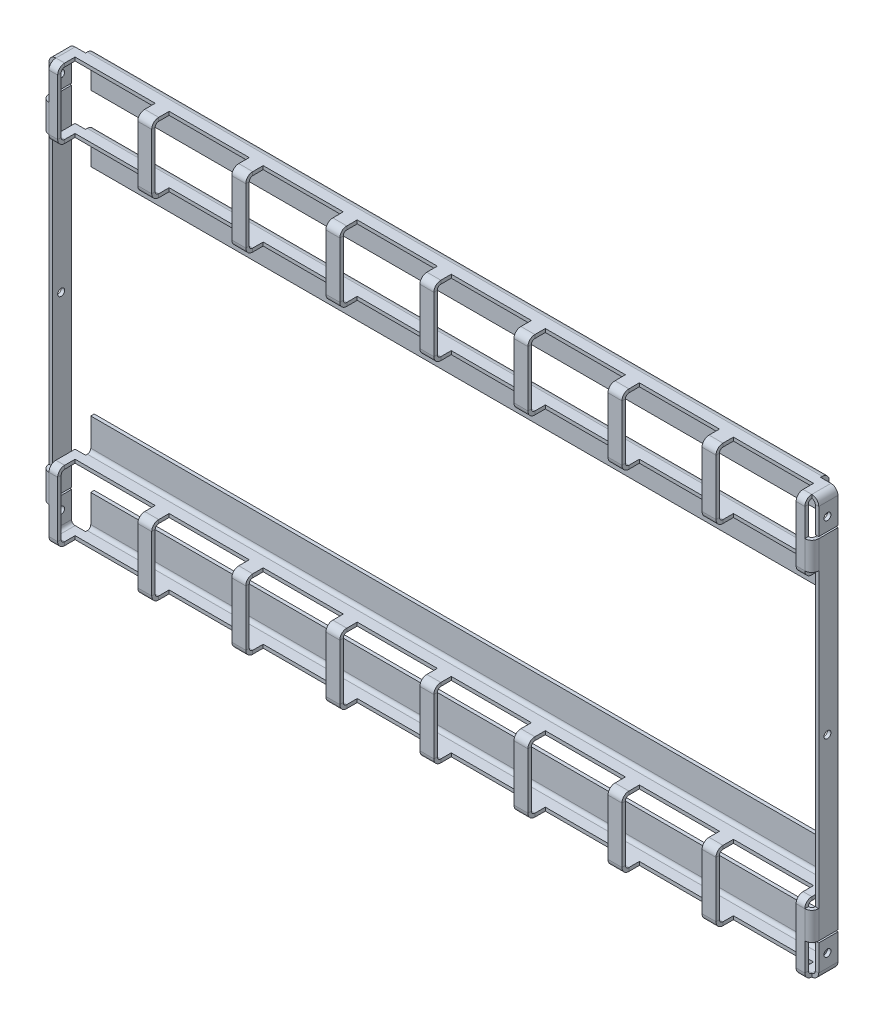
from build123d import *

# Parameters (mm, degrees)
SKETCH1_W                      = 442
SKETCH1_H                      = 40
BASE_FLANGE1_DEPTH             = 2
EDGE_FLANGE1_STRIP_W           = 12
EDGE_FLANGE1_STRIP_H           = 2
EDGE_FLANGE1_STRIP_CUT_DEPTH   = 40
EDGE_FLANGE1_STRIP_2_W         = 12
EDGE_FLANGE1_STRIP_2_H         = 2
EDGE_FLANGE1_STRIP_CUT_2_DEPTH = 40
EDGE_FLANGE1_DEPTH             = 40
EDGE_FLANGE1_PROFILE_W         = 120
EDGE_FLANGE1_PROFILE_H         = 16
EDGE_FLANGE1_FLAT_DEPTH        = 2
EDGE_FLANGE1_BEND_DEPTH        = 40
EDGE_FLANGE1_PROFILE_2_W       = 120
EDGE_FLANGE1_PROFILE_2_H       = 16
EDGE_FLANGE1_FLAT_2_DEPTH      = 2
EDGE_FLANGE2_STRIP_W           = 12
EDGE_FLANGE2_STRIP_H           = 2
EDGE_FLANGE2_STRIP_CUT_DEPTH   = 434
EDGE_FLANGE2_STRIP_2_W         = 12
EDGE_FLANGE2_STRIP_2_H         = 2
EDGE_FLANGE2_STRIP_CUT_2_DEPTH = 434
EDGE_FLANGE2_DEPTH             = 434
EDGE_FLANGE2_BEND_DEPTH        = 434
SKETCH19_W                     = 46
SKETCH19_H                     = 10
CUT_EXTRUDE1_DEPTH             = 450.626511674
SKETCH20_W                     = 4.121380152
SKETCH20_H                     = 20
SKETCH20_W_2                   = 4.048351904
CUT_EXTRUDE2_DEPTH             = 20
SKETCH21_W                     = 5.399389361
SKETCH21_H                     = 4
SKETCH21_W_2                   = 4.014115574
CUT_EXTRUDE3_DEPTH             = 4
EDGE_FLANGE3_DEPTH             = 16
EDGE_FLANGE3_BEND_DEPTH        = 16
EDGE_FLANGE4_STRIP_W           = 12
EDGE_FLANGE4_STRIP_H           = 2
EDGE_FLANGE4_STRIP_CUT_DEPTH   = 434
EDGE_FLANGE4_STRIP_2_W         = 12
EDGE_FLANGE4_STRIP_2_H         = 2
EDGE_FLANGE4_STRIP_CUT_2_DEPTH = 434
EDGE_FLANGE4_DEPTH             = 434
EDGE_FLANGE4_BEND_DEPTH        = 434
SKETCH35_W                     = 5
SKETCH35_H                     = 120
CUT_EXTRUDE5_DEPTH             = 10
SKETCH42_W                     = 5
SKETCH42_H                     = 120
CUT_EXTRUDE6_DEPTH             = 10
SKETCH28_R                     = 2
CUT_EXTRUDE4_DEPTH             = 504.352759007


# Sheet-metal steps are written as plain solids
with BuildPart() as part:
    # Sketch1 → Base-Flange1 (new body)
    with BuildSketch(Plane.XY):
        with Locations((221, 20)):
            Rectangle(SKETCH1_W, SKETCH1_H)
    extrude(amount=-BASE_FLANGE1_DEPTH)

    # Edge-Flange1 strip (across the edge) → Edge-Flange1 strip cut (cut)
    with BuildSketch(Plane(origin=(442, 40, -2), x_dir=(-1, 0, 0), z_dir=(0, -1, 0))):
        with Locations((-2, -1)):
            Rectangle(EDGE_FLANGE1_STRIP_W, EDGE_FLANGE1_STRIP_H)
    extrude(amount=EDGE_FLANGE1_STRIP_CUT_DEPTH, mode=Mode.SUBTRACT)

    # Edge-Flange1 strip 2 (across the edge) → Edge-Flange1 strip cut 2 (cut)
    with BuildSketch(Plane(origin=(0, 0, -2), x_dir=(1, 0, 0), z_dir=(0, 1, 0))):
        with Locations((-2, -1)):
            Rectangle(EDGE_FLANGE1_STRIP_2_W, EDGE_FLANGE1_STRIP_2_H)
    extrude(amount=EDGE_FLANGE1_STRIP_CUT_2_DEPTH, mode=Mode.SUBTRACT)

    # Edge-Flange1 bend section (across the edge) → Edge-Flange1 (add)
    with BuildSketch(Plane(origin=(442, 40, -2), x_dir=(-1, 0, 0), z_dir=(0, -1, 0))):
        with BuildLine():
            Line((0, 2), (2, 2))
            ThreePointArc((2, 2), (2.585786438, 0.585786438), (4, 0))
            Line((4, 0), (4, -2))
            ThreePointArc((4, -2), (1.171572875, -0.828427125), (0, 2))
        make_face()
    extrude(amount=EDGE_FLANGE1_DEPTH)

    # Edge-Flange1 profile (on flange) → Edge-Flange1 flat (add)
    with BuildSketch(Plane(origin=(442, 0, -2), x_dir=(0, -1, 0), z_dir=(1, 0, 0))):
        with Locations((-60, 10)):
            Rectangle(EDGE_FLANGE1_PROFILE_W, EDGE_FLANGE1_PROFILE_H)
    extrude(amount=-EDGE_FLANGE1_FLAT_DEPTH)

    # Edge-Flange1 bend section 2 (across the edge) → Edge-Flange1 bend (add)
    with BuildSketch(Plane(origin=(0, 0, -2), x_dir=(1, 0, 0), z_dir=(0, 1, 0))):
        with BuildLine():
            Line((0, 2), (2, 2))
            ThreePointArc((2, 2), (2.585786438, 0.585786438), (4, 0))
            Line((4, 0), (4, -2))
            ThreePointArc((4, -2), (1.171572875, -0.828427125), (0, 2))
        make_face()
    extrude(amount=EDGE_FLANGE1_BEND_DEPTH)

    # Edge-Flange1 profile 2 (on flange) → Edge-Flange1 flat 2 (add)
    with BuildSketch(Plane(origin=(0, 0, -2), x_dir=(0, 1, 0), z_dir=(-1, 0, 0))):
        with Locations((60, 10)):
            Rectangle(EDGE_FLANGE1_PROFILE_2_W, EDGE_FLANGE1_PROFILE_2_H)
    extrude(amount=-EDGE_FLANGE1_FLAT_2_DEPTH)

    # Edge-Flange2 strip (across the edge) → Edge-Flange2 strip cut (cut)
    with BuildSketch(Plane(origin=(4, 40, -2), x_dir=(0, -1, 0), z_dir=(1, 0, 0))):
        with Locations((-2, -1)):
            Rectangle(EDGE_FLANGE2_STRIP_W, EDGE_FLANGE2_STRIP_H)
    extrude(amount=EDGE_FLANGE2_STRIP_CUT_DEPTH, mode=Mode.SUBTRACT)

    # Edge-Flange2 strip 2 (across the edge) → Edge-Flange2 strip cut 2 (cut)
    with BuildSketch(Plane(origin=(438, 0, -2), x_dir=(0, 1, 0), z_dir=(-1, 0, 0))):
        with Locations((-2, -1)):
            Rectangle(EDGE_FLANGE2_STRIP_2_W, EDGE_FLANGE2_STRIP_2_H)
    extrude(amount=EDGE_FLANGE2_STRIP_CUT_2_DEPTH, mode=Mode.SUBTRACT)

    # Edge-Flange2 section (across the edge) → Edge-Flange2 (add)
    with BuildSketch(Plane(origin=(4, 40, -2), x_dir=(0, -1, 0), z_dir=(1, 0, 0))):
        with BuildLine():
            Line((0, 2), (0, 18))
            Line((0, 18), (2, 18))
            Line((2, 18), (2, 2))
            ThreePointArc((2, 2), (2.585786438, 0.585786438), (4, 0))
            Line((4, 0), (4, -2))
            ThreePointArc((4, -2), (1.171572875, -0.828427125), (0, 2))
        make_face()
    extrude(amount=EDGE_FLANGE2_DEPTH)

    # Edge-Flange2 section 2 (across the edge) → Edge-Flange2 bend (add)
    with BuildSketch(Plane(origin=(438, 0, -2), x_dir=(0, 1, 0), z_dir=(-1, 0, 0))):
        with BuildLine():
            Line((0, 2), (0, 18))
            Line((0, 18), (2, 18))
            Line((2, 18), (2, 2))
            ThreePointArc((2, 2), (2.585786438, 0.585786438), (4, 0))
            Line((4, 0), (4, -2))
            ThreePointArc((4, -2), (1.171572875, -0.828427125), (0, 2))
        make_face()
    extrude(amount=EDGE_FLANGE2_BEND_DEPTH)

    # Sketch19 → Cut-Extrude1 (cut, through all)
    with BuildSketch(Plane(origin=(0, 40, 0), x_dir=(1, 0, 0), z_dir=(0, 1, 0))):
        with Locations((194, 5)):
            Rectangle(SKETCH19_W, SKETCH19_H)
        with Locations((140, 5)):
            Rectangle(SKETCH19_W, SKETCH19_H)
        with Locations((86, 5)):
            Rectangle(SKETCH19_W, SKETCH19_H)
        with Locations((32, 5)):
            Rectangle(SKETCH19_W, SKETCH19_H)
        with Locations((410, 5)):
            Rectangle(SKETCH19_W, SKETCH19_H)
        with Locations((356, 5)):
            Rectangle(SKETCH19_W, SKETCH19_H)
        with Locations((302, 5)):
            Rectangle(SKETCH19_W, SKETCH19_H)
        with Locations((248, 5)):
            Rectangle(SKETCH19_W, SKETCH19_H)
    extrude(amount=-CUT_EXTRUDE1_DEPTH, mode=Mode.SUBTRACT)

    # Sketch20 → Cut-Extrude2 (cut)
    with BuildSketch(Plane.XZ):
        with Locations((1.939309924, -10)):
            Rectangle(SKETCH20_W, SKETCH20_H)
        with Locations((440.024175952, -10)):
            Rectangle(SKETCH20_W_2, SKETCH20_H)
    extrude(amount=-CUT_EXTRUDE2_DEPTH, mode=Mode.SUBTRACT)

    # Sketch21 → Cut-Extrude3 (cut)
    with BuildSketch(Plane.XY):
        with Locations((1.30030532, 38)):
            Rectangle(SKETCH21_W, SKETCH21_H)
        with Locations((440.007057787, 38)):
            Rectangle(SKETCH21_W_2, SKETCH21_H)
    extrude(amount=-CUT_EXTRUDE3_DEPTH, mode=Mode.SUBTRACT)

    # Edge-Flange3 section (across the edge) → Edge-Flange3 (add)
    with BuildSketch(Plane(origin=(2, 2, -20), x_dir=(1, 0, 0), z_dir=(0, 0, 1))):
        with BuildLine():
            Line((-2, 2), (-2, 17))
            Line((-2, 17), (0, 17))
            Line((0, 17), (0, 2))
            ThreePointArc((0, 2), (0.585786438, 0.585786438), (2, 0))
            Line((2, 0), (2, -2))
            ThreePointArc((2, -2), (-0.828427125, -0.828427125), (-2, 2))
        make_face()
    extrude(amount=EDGE_FLANGE3_DEPTH)

    # Edge-Flange3 section 2 (across the edge) → Edge-Flange3 bend (add)
    with BuildSketch(Plane(origin=(440, 2, -4), x_dir=(-1, 0, 0), z_dir=(0, 0, -1))):
        with BuildLine():
            Line((-2, 2), (-2, 17))
            Line((-2, 17), (0, 17))
            Line((0, 17), (0, 2))
            ThreePointArc((0, 2), (0.585786438, 0.585786438), (2, 0))
            Line((2, 0), (2, -2))
            ThreePointArc((2, -2), (-0.828427125, -0.828427125), (-2, 2))
        make_face()
    extrude(amount=EDGE_FLANGE3_BEND_DEPTH)

    # Edge-Flange4 strip (across the edge) → Edge-Flange4 strip cut (cut)
    with BuildSketch(Plane(origin=(438, 2, -20), x_dir=(0, 0, 1), z_dir=(-1, 0, 0))):
        with Locations((-2, -1)):
            Rectangle(EDGE_FLANGE4_STRIP_W, EDGE_FLANGE4_STRIP_H)
    extrude(amount=EDGE_FLANGE4_STRIP_CUT_DEPTH, mode=Mode.SUBTRACT)

    # Edge-Flange4 strip 2 (across the edge) → Edge-Flange4 strip cut 2 (cut)
    with BuildSketch(Plane(origin=(438, 40, -20), x_dir=(0, 0, 1), z_dir=(-1, 0, 0))):
        with Locations((-2, -1)):
            Rectangle(EDGE_FLANGE4_STRIP_2_W, EDGE_FLANGE4_STRIP_2_H)
    extrude(amount=EDGE_FLANGE4_STRIP_CUT_2_DEPTH, mode=Mode.SUBTRACT)

    # Edge-Flange4 section (across the edge) → Edge-Flange4 (add)
    with BuildSketch(Plane(origin=(438, 2, -20), x_dir=(0, 0, 1), z_dir=(-1, 0, 0))):
        with BuildLine():
            Line((0, 2), (0, 18))
            Line((0, 18), (2, 18))
            Line((2, 18), (2, 2))
            ThreePointArc((2, 2), (2.585786438, 0.585786438), (4, 0))
            Line((4, 0), (4, -2))
            ThreePointArc((4, -2), (1.171572875, -0.828427125), (0, 2))
        make_face()
    extrude(amount=EDGE_FLANGE4_DEPTH)

    # Edge-Flange4 section 2 (across the edge) → Edge-Flange4 bend (add)
    with BuildSketch(Plane(origin=(438, 40, -20), x_dir=(0, 0, 1), z_dir=(-1, 0, 0))):
        with BuildLine():
            Line((0, 2), (0, 18))
            Line((0, 18), (2, 18))
            Line((2, 18), (2, 2))
            ThreePointArc((2, 2), (2.585786438, 0.585786438), (4, 0))
            Line((4, 0), (4, -2))
            ThreePointArc((4, -2), (1.171572875, -0.828427125), (0, 2))
        make_face()
    extrude(amount=EDGE_FLANGE4_BEND_DEPTH)

    # Sketch35 → Cut-Extrude5 (cut)
    with BuildSketch(Plane(origin=(442, 0, 0), x_dir=(0, 0, -1), z_dir=(1, 0, 0))):
        with Locations((17.5, 60)):
            Rectangle(SKETCH35_W, SKETCH35_H)
    extrude(amount=-CUT_EXTRUDE5_DEPTH, mode=Mode.SUBTRACT)

    # Sketch42 → Cut-Extrude6 (cut)
    with BuildSketch(Plane.ZY):
        with Locations((-17.5, 60)):
            Rectangle(SKETCH42_W, SKETCH42_H)
    extrude(amount=-CUT_EXTRUDE6_DEPTH, mode=Mode.SUBTRACT)

    # Mirror1: part across plane


with BuildPart() as part_1:
    add(part.part)
    add(part.part.mirror(Plane(origin=(0, 120, -20), x_dir=(0, 0, 1), z_dir=(0, -1, 0))))

    # Sketch28 → Cut-Extrude4 (cut, through all)
    with BuildSketch(Plane.ZY):
        with Locations(Location((-9, 228.5, 0), (0, 0, 270))):
            Circle(SKETCH28_R)
        with Locations(Location((-9, 120, 0), (0, 0, 270))):
            Circle(SKETCH28_R)
        with Locations(Location((-9, 11.5, 0), (0, 0, 270))):
            Circle(SKETCH28_R)
    extrude(amount=-CUT_EXTRUDE4_DEPTH, mode=Mode.SUBTRACT)


solid = part_1.part
